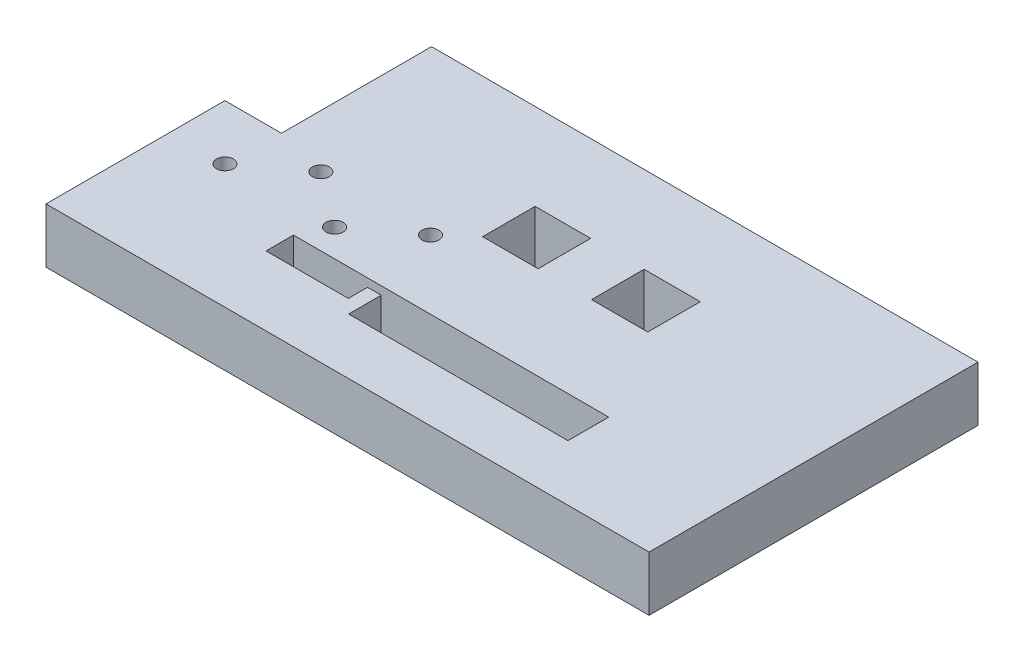
from build123d import *

# Parameters (mm, degrees)
SKETCH1_W           = 220
SKETCH1_H           = 120
BOSS_EXTRUDE1_DEPTH = 20
CUT_EXTRUDE1_REACH  = 128.886
SKETCH2_W           = 20.632503002
SKETCH2_H           = 54.730004003
CUT_EXTRUDE2_REACH  = 128.886
SKETCH3_W           = 20.25
SKETCH3_H           = 19.16
SKETCH3_W_2         = 20.5
CUT_EXTRUDE3_REACH  = 128.886
SKETCH4_W           = 80
SKETCH4_H           = 14.88
CUT_EXTRUDE4_REACH  = 128.886
SKETCH8_R           = 3.1
CUT_EXTRUDE5_REACH  = 128.886


with BuildPart() as part:
    # Sketch1 → Boss-Extrude1 (new body)
    with BuildSketch(Plane(origin=(0, 0, 0), x_dir=(1, 0, 0), z_dir=(0, 1, 0))):
        Rectangle(SKETCH1_W, SKETCH1_H)
    extrude(amount=-BOSS_EXTRUDE1_DEPTH)

    # Sketch2 → Cut-Extrude1 (cut, up to next)
    with BuildSketch(Plane(origin=(0, 0, 0), x_dir=(1, 0, 0), z_dir=(0, 1, 0)), mode=Mode.PRIVATE) as cut_extrude1_sk1:
        with Locations((-99.683748499, 32.634997999)):
            Rectangle(SKETCH2_W, SKETCH2_H)
    cut_extrude1_tool1 = extrude(cut_extrude1_sk1.sketch, amount=-CUT_EXTRUDE1_REACH, mode=Mode.PRIVATE) & part.part
    add(cut_extrude1_tool1.solids().sort_by_distance((-99.683748, 0, -32.634998))[0], mode=Mode.SUBTRACT)

    # Sketch3 → Cut-Extrude2 (cut, up to next)
    with BuildSketch(Plane(origin=(0, 0, 0), x_dir=(1, 0, 0), z_dir=(0, 1, 0)), mode=Mode.PRIVATE) as cut_extrude2_sk1:
        with Locations((-9.875, 18.86)):
            Rectangle(SKETCH3_W, SKETCH3_H)
    cut_extrude2_tool1 = extrude(cut_extrude2_sk1.sketch, amount=-CUT_EXTRUDE2_REACH, mode=Mode.PRIVATE) & part.part
    # Sketch3 → Cut-Extrude2 (cut, up to next)
    with BuildSketch(Plane(origin=(0, 0, 0), x_dir=(1, 0, 0), z_dir=(0, 1, 0)), mode=Mode.PRIVATE) as cut_extrude2_sk2:
        with Locations((30, 18.86)):
            Rectangle(SKETCH3_W_2, SKETCH3_H)
    cut_extrude2_tool2 = extrude(cut_extrude2_sk2.sketch, amount=-CUT_EXTRUDE2_REACH, mode=Mode.PRIVATE) & part.part
    add(cut_extrude2_tool1.solids().sort_by_distance((-9.875, 0, -18.86))[0], mode=Mode.SUBTRACT)
    add(cut_extrude2_tool2.solids().sort_by_distance((30, 0, -18.86))[0], mode=Mode.SUBTRACT)

    # Sketch4 → Cut-Extrude3 (cut, up to next)
    with BuildSketch(Plane(origin=(0, 0, 0), x_dir=(1, 0, 0), z_dir=(0, 1, 0)), mode=Mode.PRIVATE) as cut_extrude3_sk1:
        with Locations((20, -32.16)):
            Rectangle(SKETCH4_W, SKETCH4_H)
    cut_extrude3_tool1 = extrude(cut_extrude3_sk1.sketch, amount=-CUT_EXTRUDE3_REACH, mode=Mode.PRIVATE) & part.part
    add(cut_extrude3_tool1.solids().sort_by_distance((20, 0, 32.16))[0], mode=Mode.SUBTRACT)

    # Sketch8 → Cut-Extrude4 (cut, up to next)
    with BuildSketch(Plane(origin=(0, 0, 0), x_dir=(1, 0, 0), z_dir=(0, 1, 0)), mode=Mode.PRIVATE) as cut_extrude4_sk1:
        with Locations((-90, -14.72)):
            Circle(SKETCH8_R)
    cut_extrude4_tool1 = extrude(cut_extrude4_sk1.sketch, amount=-CUT_EXTRUDE4_REACH, mode=Mode.PRIVATE) & part.part
    # Sketch8 → Cut-Extrude4 (cut, up to next)
    with BuildSketch(Plane(origin=(0, 0, 0), x_dir=(1, 0, 0), z_dir=(0, 1, 0)), mode=Mode.PRIVATE) as cut_extrude4_sk2:
        with Locations((-30, 0.28)):
            Circle(SKETCH8_R)
    cut_extrude4_tool2 = extrude(cut_extrude4_sk2.sketch, amount=-CUT_EXTRUDE4_REACH, mode=Mode.PRIVATE) & part.part
    # Sketch8 → Cut-Extrude4 (cut, up to next)
    with BuildSketch(Plane(origin=(0, 0, 0), x_dir=(1, 0, 0), z_dir=(0, 1, 0)), mode=Mode.PRIVATE) as cut_extrude4_sk3:
        with Locations((-70, 0.28)):
            Circle(SKETCH8_R)
    cut_extrude4_tool3 = extrude(cut_extrude4_sk3.sketch, amount=-CUT_EXTRUDE4_REACH, mode=Mode.PRIVATE) & part.part
    # Sketch8 → Cut-Extrude4 (cut, up to next)
    with BuildSketch(Plane(origin=(0, 0, 0), x_dir=(1, 0, 0), z_dir=(0, 1, 0)), mode=Mode.PRIVATE) as cut_extrude4_sk4:
        with Locations((-50, -14.72)):
            Circle(SKETCH8_R)
    cut_extrude4_tool4 = extrude(cut_extrude4_sk4.sketch, amount=-CUT_EXTRUDE4_REACH, mode=Mode.PRIVATE) & part.part
    add(cut_extrude4_tool1.solids().sort_by_distance((-90, 0, 14.72))[0], mode=Mode.SUBTRACT)
    add(cut_extrude4_tool2.solids().sort_by_distance((-30, 0, -0.28))[0], mode=Mode.SUBTRACT)
    add(cut_extrude4_tool3.solids().sort_by_distance((-70, 0, -0.28))[0], mode=Mode.SUBTRACT)
    add(cut_extrude4_tool4.solids().sort_by_distance((-50, 0, 14.72))[0], mode=Mode.SUBTRACT)

    # Sketch9 → Cut-Extrude5 (cut, up to next)
    with BuildSketch(Plane(origin=(0, 0, 0), x_dir=(1, 0, 0), z_dir=(0, 1, 0)), mode=Mode.PRIVATE) as cut_extrude5_sk1:
        Polygon((-20, -27.72), (-25, -27.72), (-25, -34.72), (-55, -34.72), (-55, -24.72), (-20, -24.72), align=None)
    cut_extrude5_tool1 = extrude(cut_extrude5_sk1.sketch, amount=-CUT_EXTRUDE5_REACH, mode=Mode.PRIVATE) & part.part
    add(cut_extrude5_tool1.solids().sort_by_distance((-39.166667, 0, 29.553333))[0], mode=Mode.SUBTRACT)


solid = part.part
